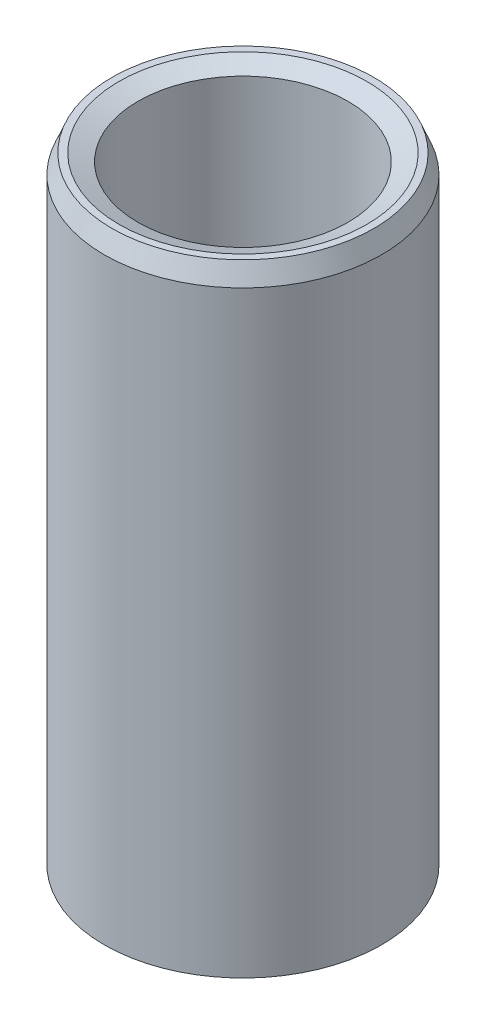
from build123d import *
from OCP.BRepFilletAPI import BRepFilletAPI_MakeChamfer

# Parameters (mm, degrees)
SKETCH1_R           = 17.5
BOSS_EXTRUDE1_DEPTH = 78.797027268
SKETCH2_R           = 13.247345897
CUT_EXTRUDE1_DEPTH  = 83.592200033
CHAMFER1_SIZE       = 2.391465007
CHAMFER1_SIZE2      = 0.972885823


with BuildPart() as part:
    # Sketch1 → Boss-Extrude1 (new body)
    with BuildSketch(Plane(origin=(0, 0, 0), x_dir=(1, 0, 0), z_dir=(0, 1, 0))):
        Circle(SKETCH1_R)
    extrude(amount=BOSS_EXTRUDE1_DEPTH)

    # Sketch2 → Cut-Extrude1 (cut, through all)
    with BuildSketch(Plane(origin=(0, 0, 0), x_dir=(1, 0, 0), z_dir=(0, 1, 0))):
        Circle(SKETCH2_R)
    extrude(amount=CUT_EXTRUDE1_DEPTH, mode=Mode.SUBTRACT)

    # Chamfer1: one chamfer whose edges measure the first distance from different faces: ONE call of the kernel's chamfer builder (chamfer() names one face for all edges)
    chamfer1_edges_1 = [part.edges().sort_by_distance(p)[0] for p in [
        (-13.247345897, 78.797027268, 0),
    ]]
    chamfer1_side_1 = [part.faces().sort_by_distance(p)[0] for p in [
        (-17.005025253, 78.797027268, 0),
    ]]
    chamfer1_edges_2 = [part.edges().sort_by_distance(p)[0] for p in [
        (-13.247345897, 0, 0),
    ]]
    chamfer1_side_2 = [part.faces().sort_by_distance(p)[0] for p in [
        (-13.247345897, 39.398513634, 0),
    ]]
    chamfer1_edges_3 = [part.edges().sort_by_distance(p)[0] for p in [
        (-17.5, 0, 0),
    ]]
    chamfer1_side_3 = [part.faces().sort_by_distance(p)[0] for p in [
        (-17.005025253, 0, 0),
    ]]
    chamfer1_edges_4 = [part.edges().sort_by_distance(p)[0] for p in [
        (-17.5, 78.797027268, 0),
    ]]
    chamfer1_side_4 = [part.faces().sort_by_distance(p)[0] for p in [
        (-17.5, 39.398513634, 0),
    ]]
    chamfer1 = BRepFilletAPI_MakeChamfer(part.part.solid().wrapped)
    for e in chamfer1_edges_1:
        chamfer1.Add(CHAMFER1_SIZE, CHAMFER1_SIZE2, e.wrapped, chamfer1_side_1[0].wrapped)  # the first distance lies on this face
    for e in chamfer1_edges_2:
        chamfer1.Add(CHAMFER1_SIZE, CHAMFER1_SIZE2, e.wrapped, chamfer1_side_2[0].wrapped)  # the first distance lies on this face
    for e in chamfer1_edges_3:
        chamfer1.Add(CHAMFER1_SIZE, CHAMFER1_SIZE2, e.wrapped, chamfer1_side_3[0].wrapped)  # the first distance lies on this face
    for e in chamfer1_edges_4:
        chamfer1.Add(CHAMFER1_SIZE, CHAMFER1_SIZE2, e.wrapped, chamfer1_side_4[0].wrapped)  # the first distance lies on this face
    add(Compound.cast(chamfer1.Shape()), mode=Mode.REPLACE)


solid = part.part
